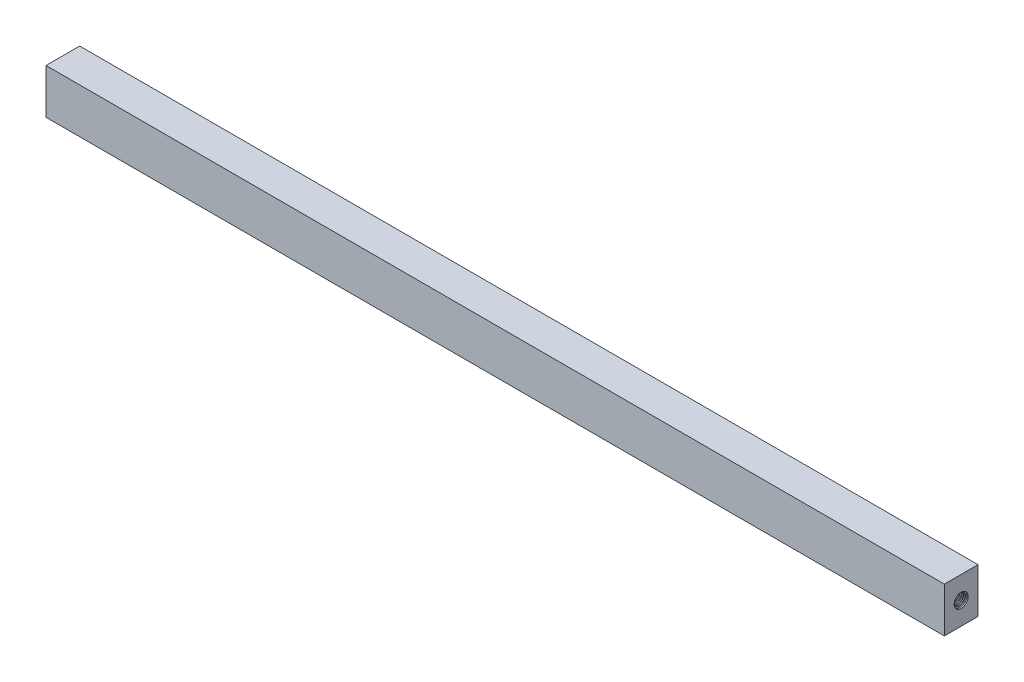
from build123d import *
from build123d.topology import SkipClean

# Parameters (mm, degrees)
SKETCH1_W           = 508
SKETCH1_H           = 25.4
BOSS_EXTRUDE1_DEPTH = 19.05
SKETCH2_R           = 3.96875
CUT_EXTRUDE1_DEPTH  = 25.4
THREAD1_PITCH       = 1.058333333


with BuildPart() as part:
    # Sketch1 → Boss-Extrude1 (new body)
    with BuildSketch(Plane.XY):
        with Locations((254, 12.7)):
            Rectangle(SKETCH1_W, SKETCH1_H)
    extrude(amount=-BOSS_EXTRUDE1_DEPTH)

    # Sketch2 → Cut-Extrude1 (cut)
    with BuildSketch(Plane(origin=(508, 0, 0), x_dir=(0, 0, -1), z_dir=(1, 0, 0))):
        with Locations((9.525, 12.7)):
            Circle(SKETCH2_R)
    extrude(amount=-CUT_EXTRUDE1_DEPTH, mode=Mode.SUBTRACT)

    # Thread1: the profile of Thread Profile1 profile screwed along a right-hand helix of 24 turns, 8 arcs to a turn; built about Z, then put on its axis
    with SkipClean():  # the faces are left unmerged after this step: merging them gives an invalid solid
        thread1_z = Axis((0, 0, 0), (0, 0, 1))
        thread1_corners = [(3.96905, 0, -0.000173205), (3.96905, 0, 0.926214869), (3.395910282, 0, 0.595312499), (3.395910282, 0, 0.330729165)]
        with BuildLine(mode=Mode.PRIVATE) as thread1_profile:
            Line(thread1_corners[0], thread1_corners[1])
            Line(thread1_corners[1], thread1_corners[2])
            Line(thread1_corners[2], thread1_corners[3])
            Line(thread1_corners[3], thread1_corners[0])
        thread1_cap = Face(thread1_profile.wire())
        thread1_turn_angles = [0, 22.5, 45, 67.5, 90, 112.5, 135, 157.5, 180, 202.5, 225, 247.5, 270, 292.5, 315, 337.5, 360]
        thread1_turn_weights = [1, 0.9238795325112867, 1, 0.9238795325112867, 1, 0.9238795325112867, 1, 0.9238795325112867, 1, 0.9238795325112867, 1, 0.9238795325112867, 1, 0.9238795325112867, 1, 0.9238795325112867, 1]
        thread1_turn_rails = [Edge.make_bspline([Vector(p[0], p[1], 0).rotate(thread1_z, thread1_turn_angles[k]) / thread1_turn_weights[k] + Vector(0, 0, p[2] + THREAD1_PITCH * thread1_turn_angles[k] / 360) for k in range(17)], [0, 0, 0, 1, 1, 2, 2, 3, 3, 4, 4, 5, 5, 6, 6, 7, 7, 8, 8, 8], 2, thread1_turn_weights) for p in thread1_corners]
        thread1_turn_sides = [Face.make_surface_from_curves(thread1_turn_rails[p[0]], thread1_turn_rails[p[1]]) for p in [(0, 1), (1, 2), (2, 3), (3, 0)]]
        thread1 = Plane(origin=(508, 12.7, -9.525), x_dir=(0, 0, 1), z_dir=(-1, 0, 0)) * Solid(Shell([*[p.moved(Location((0, 0, THREAD1_PITCH * i))) for i in range(24) for p in thread1_turn_sides], thread1_cap, thread1_cap.rotate(thread1_z, 8640).moved(Location((0, 0, THREAD1_PITCH * 8640 / 360)))]))
        add(thread1)


solid = part.part
